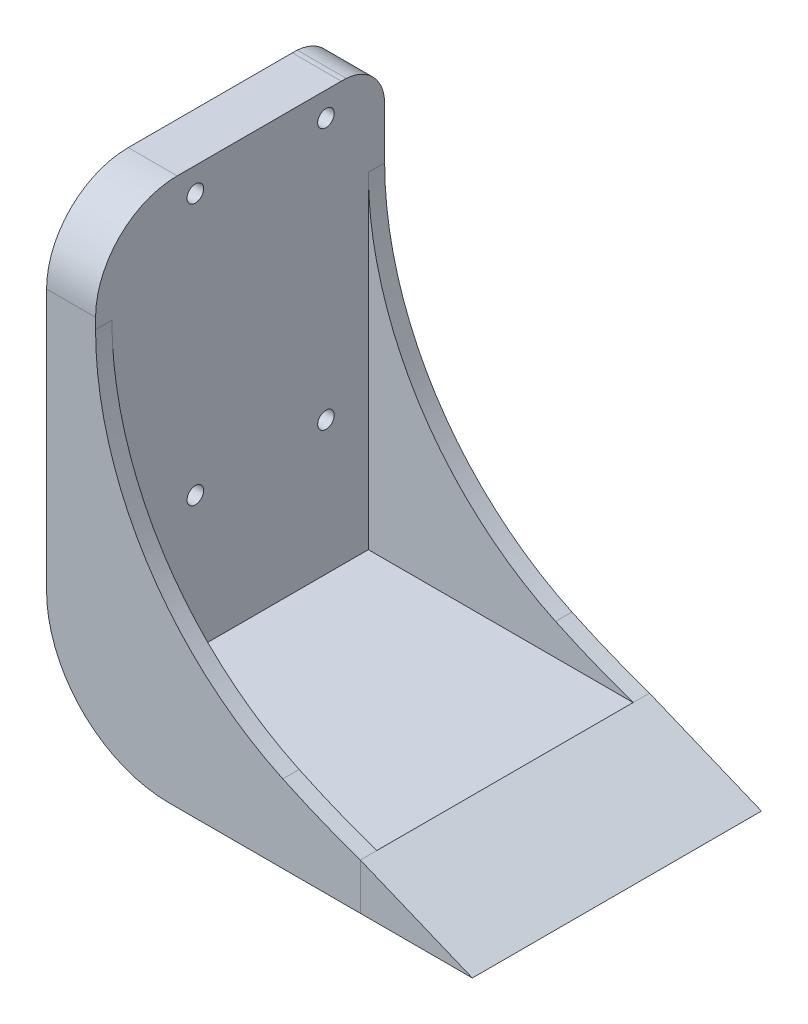
from build123d import *

# Parameters (mm, degrees)
BOSS_EXTRUDE1_DEPTH     = 40.1
SKETCH3_R               = 1.35
CUT_EXTRUDE2_DEPTH      = 50.8
SKETCH4_R               = 1.016
CUT_EXTRUDE3_DEPTH      = 50.8
SKETCH6_W               = 62.086073973
SKETCH6_H               = 34.1
CUT_EXTRUDE4_DEPTH      = 6
BOSS_EXTRUDE5_DEPTH     = 2
SKETCH17_W              = 82.769776053
SKETCH17_H              = 17.379876248
CUT_EXTRUDE6_DEPTH      = 109.051490873
FILLET1_R               = 40
FILLET2_R               = 10
SKETCH18_W              = 43.778644302
SKETCH18_H              = 21.802108688
CUT_EXTRUDE7_DEPTH      = 103.282252926
SKETCH19_W              = 38.173171743
SKETCH19_H              = 5.655063101
BOSS_EXTRUDE6_DEPTH     = 40
FILLET3_R               = 15
BOSS_EXTRUDE7_DEPTH     = 40.005
CUT_EXTRUDE8_DEPTH      = 99.423070594
CUT_EXTRUDE8_DEPTH_BACK = 40
SKETCH22_W              = 21.621158957
SKETCH22_H              = 64.89245803
CUT_EXTRUDE9_DEPTH      = 40
FILLET6_R               = 5
CUT_EXTRUDE10_START     = -2
CUT_EXTRUDE10_DEPTH     = 2
FILLET7_R               = 40


# Read off the part's stored shape, not the designer's step: Cut-Extrude10
with BuildPart() as part:
    # Sketch1 → Boss-Extrude1 (new body)
    with BuildSketch(Plane.XY):
        Polygon((0, 0), (0, 65.5066), (6, 65.5066), (6, 8.5), (76, 8.5), (76, 0), align=None)
    extrude(amount=BOSS_EXTRUDE1_DEPTH)

    # Sketch3 → Cut-Extrude2 (cut)
    with BuildSketch(Plane.XY.offset(40.1)):
        with Locations((27.996, 2.8)):
            Circle(SKETCH3_R)
        with Locations((49.996, 2.8)):
            Circle(SKETCH3_R)
        with Locations((71.996, 2.8)):
            Circle(SKETCH3_R)
    extrude(amount=-CUT_EXTRUDE2_DEPTH, mode=Mode.SUBTRACT)

    # Sketch4 → Cut-Extrude3 (cut)
    with BuildSketch(Plane.ZY):
        with Locations((27.88, 30.5286)):
            Circle(SKETCH4_R)
        with Locations(Location((11.88, 30.5286, 0), (0, 0, 270))):
            Circle(SKETCH4_R)
        with Locations((27.88, 62.5286)):
            Circle(SKETCH4_R)
        with Locations(Location((11.88, 62.5286, 0), (0, 0, 270))):
            Circle(SKETCH4_R)
    extrude(amount=-CUT_EXTRUDE3_DEPTH, mode=Mode.SUBTRACT)

    # Sketch6 → Cut-Extrude4 (cut)
    with BuildSketch(Plane.XZ):
        with Locations((50.043036987, 20.05)):
            Rectangle(SKETCH6_W, SKETCH6_H)
    extrude(amount=-CUT_EXTRUDE4_DEPTH, mode=Mode.SUBTRACT)

    # Sketch16 → Boss-Extrude5 (add)
    with BuildSketch(Plane.XY.offset(40.1)):
        with BuildLine():
            Line((6, 8.5), (26, 8.5))
            Line((26, 8.5), (67.546536443, 8.5))
            add(Edge.make_bspline(
                [(6, 33.5), (30.451597349, 10.92406084), (67.546536443, 8.5)],
                knots=[0, 0, 0, 1, 1, 1], degree=2))
            Line((6, 33.5), (6, 8.5))
        make_face()
    boss_extrude5 = extrude(amount=-BOSS_EXTRUDE5_DEPTH)

    # Mirror2: Boss-Extrude5 across plane
    add(boss_extrude5.mirror(Plane(origin=(0, 0, 20.05), x_dir=(1, 0, 0), z_dir=(0, 0, -1))))

    # Sketch17 → Cut-Extrude6 (cut, through all)
    with BuildSketch(Plane.XY.offset(40.1)):
        with Locations((41.384888027, -0.189938124)):
            Rectangle(SKETCH17_W, SKETCH17_H)
    extrude(amount=-CUT_EXTRUDE6_DEPTH, mode=Mode.SUBTRACT)

    # Fillet1
    fillet1_edges = [part.edges().sort_by_distance(p)[0] for p in [
        (6, 33.5, 39.1),
        (6, 33.5, 1),
    ]]
    fillet(fillet1_edges, radius=FILLET1_R)

    # Fillet2
    fillet2_edges = [part.edges().sort_by_distance(p)[0] for p in [
        (3, 65.5066, 40.1),
        (3, 65.5066, 0),
    ]]
    fillet(fillet2_edges, radius=FILLET2_R)

    # Sketch18 → Cut-Extrude7 (cut, through all)
    with BuildSketch(Plane(origin=(0, 0, 0), x_dir=(-1, 0, 0), z_dir=(0, 0, -1))):
        with Locations((-60.319999127, 19.401054344)):
            Rectangle(SKETCH18_W, SKETCH18_H)
    extrude(amount=-CUT_EXTRUDE7_DEPTH, mode=Mode.SUBTRACT)

    # Sketch19 → Boss-Extrude6 (add)
    with BuildSketch(Plane.XY.offset(40.1)):
        with Locations((19.344091105, 11.327531551)):
            Rectangle(SKETCH19_W, SKETCH19_H)
    extrude(amount=-BOSS_EXTRUDE6_DEPTH)

    # Fillet3
    fillet3_edges = [part.edges().sort_by_distance(p)[0] for p in [
        (0, 8.5, 20.05),
    ]]
    fillet(fillet3_edges, radius=FILLET3_R)

    # Mirror3: Boss-Extrude5 across plane
    add(boss_extrude5.mirror(Plane(origin=(0, 0, 22.396281632), x_dir=(1, 0, 0), z_dir=(0, 0, -1))))


with BuildPart() as body_2:
    # Sketch20 → Boss-Extrude7 (new body)
    with BuildSketch(Plane.XY.offset(40.1)):
        Polygon((38.430676976, 8.5), (52.146676976, 8.5), (38.430676976, 14.155063101), align=None)
    extrude(amount=-BOSS_EXTRUDE7_DEPTH)


with BuildPart() as cut_extrude8_tool:
    # Sketch22 → Cut-Extrude8 (new, two sides: drawn at the far end of the back side and taken through both)
    with BuildSketch(Plane(origin=(6, 0, 0), x_dir=(0, 0, -1), z_dir=(1, 0, 0)).offset(-CUT_EXTRUDE8_DEPTH_BACK)):
        with Locations((6.118016215, 40.946229015)):
            Rectangle(SKETCH22_W, SKETCH22_H)
    extrude(amount=CUT_EXTRUDE8_DEPTH + CUT_EXTRUDE8_DEPTH_BACK)


with BuildPart() as part_1:
    add(part.part)

    # Cut-Extrude8: cut by cut_extrude8_tool
    add(cut_extrude8_tool.part, mode=Mode.SUBTRACT)

    # Sketch23 → Cut-Extrude9 (cut)
    with BuildSketch(Plane.XY.offset(40.1)):
        Polygon((38.430676976, 14.155063101), (52.146676976, 8.5), (77.553458586, 8.5), align=None)
    extrude(amount=-CUT_EXTRUDE9_DEPTH, mode=Mode.SUBTRACT)

    # Fillet6
    fillet6_edges = [part_1.edges().sort_by_distance(p)[0] for p in [
        (3, 63.981923905, 4.692563264),
    ]]
    fillet(fillet6_edges, radius=FILLET6_R)

    # Cut-Extrude10 outline → Cut-Extrude10 (cut)
    with BuildSketch(Plane.XY.offset(6.692563264).offset(CUT_EXTRUDE10_START)):
        with BuildLine():
            Line((6, 8.5), (15, 8.5))
            add(Edge.make_bspline(
                [(15, 8.5), (10.013167019, 8.539501058), (6, 11.5)],
                knots=[0, 0, 0, 1, 1, 1], degree=2))
            Line((6, 11.5), (6, 8.5))
        make_face()
    extrude(amount=CUT_EXTRUDE10_DEPTH, mode=Mode.SUBTRACT)

    # Fillet7
    fillet7_edges = [part_1.edges().sort_by_distance(p)[0] for p in [
        (6, 33.5, 5.692563264),
    ]]
    fillet(fillet7_edges, radius=FILLET7_R)


with BuildPart() as body_2_1:
    add(body_2.part)

    # Cut-Extrude8: cut by cut_extrude8_tool
    add(cut_extrude8_tool.part, mode=Mode.SUBTRACT)


solid = Compound([part_1.part, body_2_1.part])
